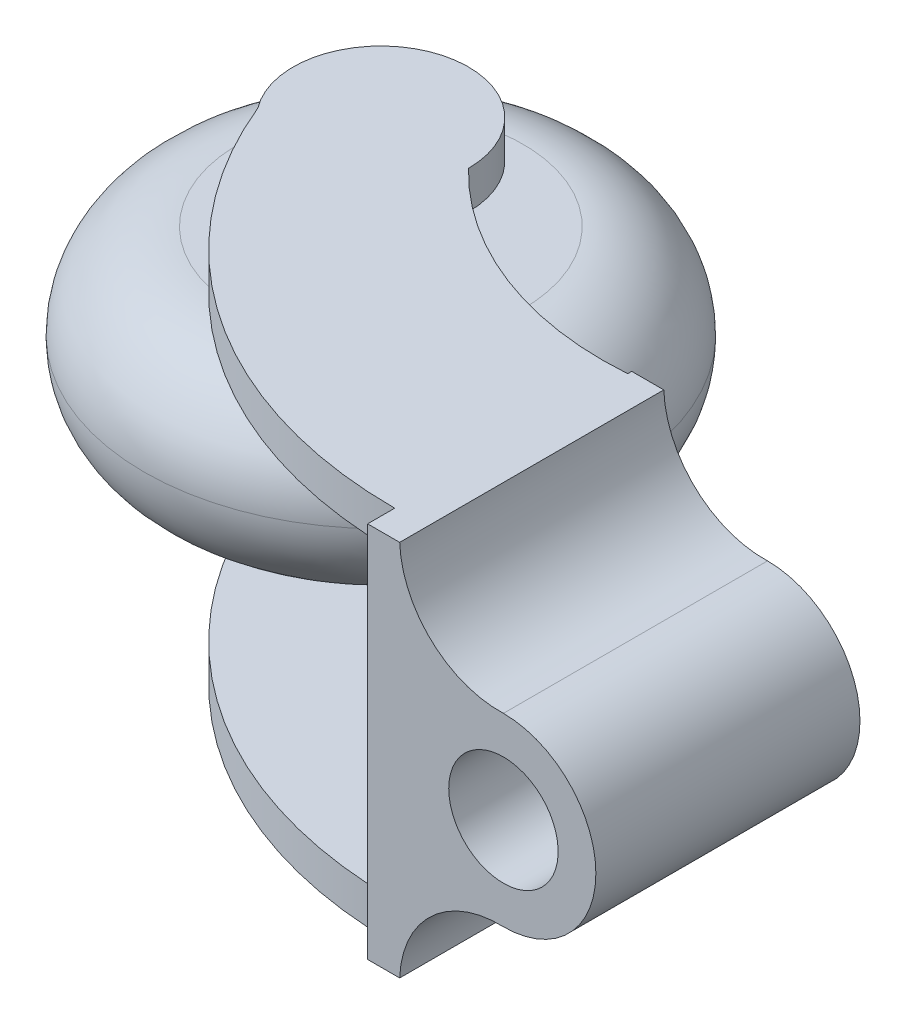
from build123d import *

# Parameters (mm, degrees)
SKETCH1_R                = 12.55
SKETCH1_R_2              = 1.925
BOSS_EXTRUDE1_DEPTH      = 10
FILLET1_R                = 5
BOSS_EXTRUDE2_DEPTH      = 5
BOSS_EXTRUDE2_DEPTH_BACK = 15
SKETCH2_R                = 1.925
SKETCH3_R                = 1.925
BOSS_EXTRUDE3_DEPTH      = 2
BOSS_EXTRUDE4_START      = -20
BOSS_EXTRUDE4_OUTLINE_R  = 1.925
BOSS_EXTRUDE4_DEPTH      = 2
SKETCH4_W                = 12.5
SKETCH4_H                = 20
BOSS_EXTRUDE5_DEPTH      = 1.7
SKETCH5_W                = 1.7
SKETCH5_H                = 10
BOSS_EXTRUDE6_DEPTH      = 14


# Read off the part's stored shape, not the designer's step: Boss-Extrude4
with BuildPart() as part:
    # Sketch1 → Boss-Extrude1 (new body)
    with BuildSketch(Plane(origin=(0, 0, 0), x_dir=(1, 0, 0), z_dir=(0, 1, 0))):
        with Locations(Location((0, 0, 0), (0, 0, 270))):
            Circle(SKETCH1_R)
        with Locations(Location((0, 0, 0), (0, 0, 270))):
            Circle(SKETCH1_R_2, mode=Mode.SUBTRACT)
    extrude(amount=BOSS_EXTRUDE1_DEPTH)

    # Fillet1
    fillet1_edges = [part.edges().sort_by_distance(p)[0] for p in [
        (0, 0, -12.55),
        (0, 10, -12.55),
    ]]
    fillet(fillet1_edges, radius=FILLET1_R - 0.0001)  # a hair under: the kernel refuses the full size

    # Sketch2 → Boss-Extrude2 (add, two sides: drawn at the far end of the back side and taken through both)
    with BuildSketch(Plane.XZ.offset(-BOSS_EXTRUDE2_DEPTH_BACK)):
        with Locations(Location((0, 0, 0), (0, 0, 270))):
            Circle(SKETCH2_R)
    extrude(amount=BOSS_EXTRUDE2_DEPTH + BOSS_EXTRUDE2_DEPTH_BACK)

    # Sketch3 → Boss-Extrude3 (add)
    with BuildSketch(Plane.XZ.offset(5)):
        with BuildLine():
            Line((20, 5), (20, 17.5))
            ThreePointArc((20, 17.5), (5.770309443, 14.004874621), (-3.696538076, 2.821011566))
            ThreePointArc((-3.696538076, 2.821011566), (-1.488891861, -4.405190237), (4.65, 0))
            ThreePointArc((4.65, 0), (11.70086168, 4.416104641), (20, 5))
        make_face()
        with Locations(Location((0, 0, 0), (0, 0, 270))):
            Circle(SKETCH3_R, mode=Mode.SUBTRACT)
    extrude(amount=-BOSS_EXTRUDE3_DEPTH)

    # Boss-Extrude4 outline → Boss-Extrude4 (add)
    with BuildSketch(Plane.XZ.offset(5).offset(BOSS_EXTRUDE4_START)):
        with BuildLine():
            ThreePointArc((-3.696538076, 2.821011566), (-1.488891861, -4.405190237), (4.65, 0))
            ThreePointArc((4.65, 0), (11.70086168, 4.416104641), (20, 5))
            Line((20, 5), (20, 17.5))
            ThreePointArc((20, 17.5), (5.770309443, 14.004874621), (-3.696538076, 2.821011566))
        make_face()
        Circle(BOSS_EXTRUDE4_OUTLINE_R, mode=Mode.SUBTRACT)
    extrude(amount=BOSS_EXTRUDE4_DEPTH)

    # Sketch4 → Boss-Extrude5 (add)
    with BuildSketch(Plane(origin=(20, 0, 0), x_dir=(0, 0, -1), z_dir=(1, 0, 0))):
        with Locations((-11.25, 5)):
            Rectangle(SKETCH4_W, SKETCH4_H)
    extrude(amount=-BOSS_EXTRUDE5_DEPTH)

    # Sketch5 → Boss-Extrude6 (add)
    with BuildSketch(Plane(origin=(0, 0, 5), x_dir=(-1, 0, 0), z_dir=(0, 0, -1))):
        with BuildLine():
            ThreePointArc((-25.307916987, 9.896233666), (-21.967917982, 8.39623271), (-20.6, 5))
            Line((-20.6, 5), (-20, 5))
            Line((-20, 5), (-20, 15))
            ThreePointArc((-20, 15), (-21.62390923, 11.376865599), (-25.307916987, 9.896233666))
        make_face()
        with BuildLine():
            Line((-20, 5), (-20.6, 5))
            ThreePointArc((-20.6, 5), (-21.967917982, 1.60376729), (-25.307916987, 0.103766334))
            ThreePointArc((-25.307916987, 0.103766334), (-21.62390923, -1.376865599), (-20, -5))
            Line((-20, -5), (-20, 5))
        make_face()
        with BuildLine():
            ThreePointArc((-25.307916987, 0.103766334), (-21.967917982, 1.60376729), (-20.6, 5))
            Line((-20.6, 5), (-22.6, 5))
            ThreePointArc((-22.6, 5), (-25.5, 2.1), (-28.4, 5))
            Line((-28.4, 5), (-30.4, 5))
            ThreePointArc((-30.4, 5), (-28.964823228, 1.535176772), (-25.5, 0.1))
            ThreePointArc((-25.5, 0.1), (-25.403975548, 0.102752972), (-25.307916987, 0.103766334))
        make_face()
        with BuildLine():
            Line((-22.6, 5), (-20.6, 5))
            ThreePointArc((-20.6, 5), (-21.967917982, 8.39623271), (-25.307916987, 9.896233666))
            ThreePointArc((-25.307916987, 9.896233666), (-25.403975548, 9.897247028), (-25.5, 9.9))
            ThreePointArc((-25.5, 9.9), (-28.964823228, 8.464823228), (-30.4, 5))
            Line((-30.4, 5), (-28.4, 5))
            ThreePointArc((-28.4, 5), (-25.5, 7.9), (-22.6, 5))
        make_face()
        with Locations((-19.15, 0)):
            Rectangle(SKETCH5_W, SKETCH5_H)
        with Locations((-19.15, 10)):
            Rectangle(SKETCH5_W, SKETCH5_H)
    extrude(amount=-BOSS_EXTRUDE6_DEPTH)


solid = part.part
